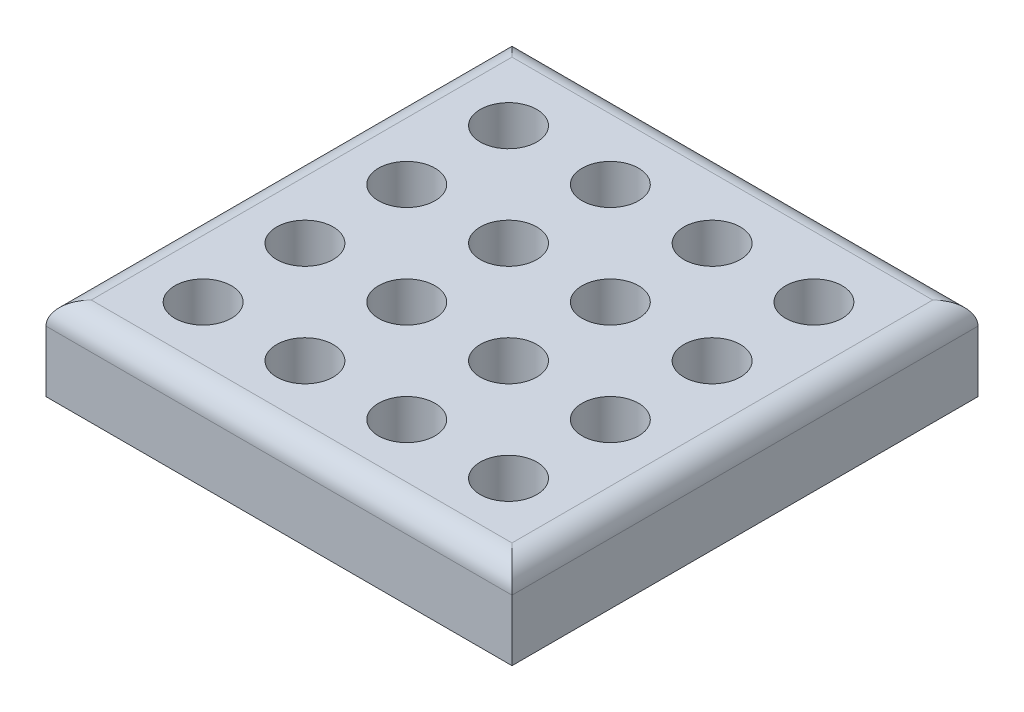
from build123d import *

# Parameters (mm, degrees)
SKETCH1_W           = 206
SKETCH1_H           = 206
BOSS_EXTRUDE1_DEPTH = 37
SKETCH2_R           = 12.5
CUT_EXTRUDE1_DEPTH  = 30
LPATTERN1_COUNT     = 4
LPATTERN1_PITCH     = 45
FILLET2_R           = 10


with BuildPart() as part:
    # Sketch1 → Boss-Extrude1 (new body)
    with BuildSketch(Plane(origin=(0, 0, 0), x_dir=(1, 0, 0), z_dir=(0, 1, 0))):
        with Locations((103, 103)):
            Rectangle(SKETCH1_W, SKETCH1_H)
    extrude(amount=BOSS_EXTRUDE1_DEPTH)

    # Sketch2 → Cut-Extrude1 (cut)
    with BuildSketch(Plane(origin=(0, 37, 0), x_dir=(1, 0, 0), z_dir=(0, 1, 0))):
        with Locations((80.5, 168.965188792)):
            Circle(SKETCH2_R)
        with Locations((35.5, 168.965188792)):
            Circle(SKETCH2_R)
        with Locations((125.5, 168.965188792)):
            Circle(SKETCH2_R)
        with Locations((170.5, 168.965188792)):
            Circle(SKETCH2_R)
    cut_extrude1 = extrude(amount=-CUT_EXTRUDE1_DEPTH, mode=Mode.SUBTRACT)

    # LPattern1: Cut-Extrude1 ×4
    with Locations(*[(0, 0, i * LPATTERN1_PITCH) for i in range(1, LPATTERN1_COUNT)]):
        add(cut_extrude1, mode=Mode.SUBTRACT)

    # Fillet2
    fillet2_edges = [part.edges().sort_by_distance(p)[0] for p in [
        (103, 37, 0),
        (206, 37, -103),
        (103, 37, -206),
        (0, 37, -103),
    ]]
    fillet(fillet2_edges, radius=FILLET2_R)


solid = part.part
